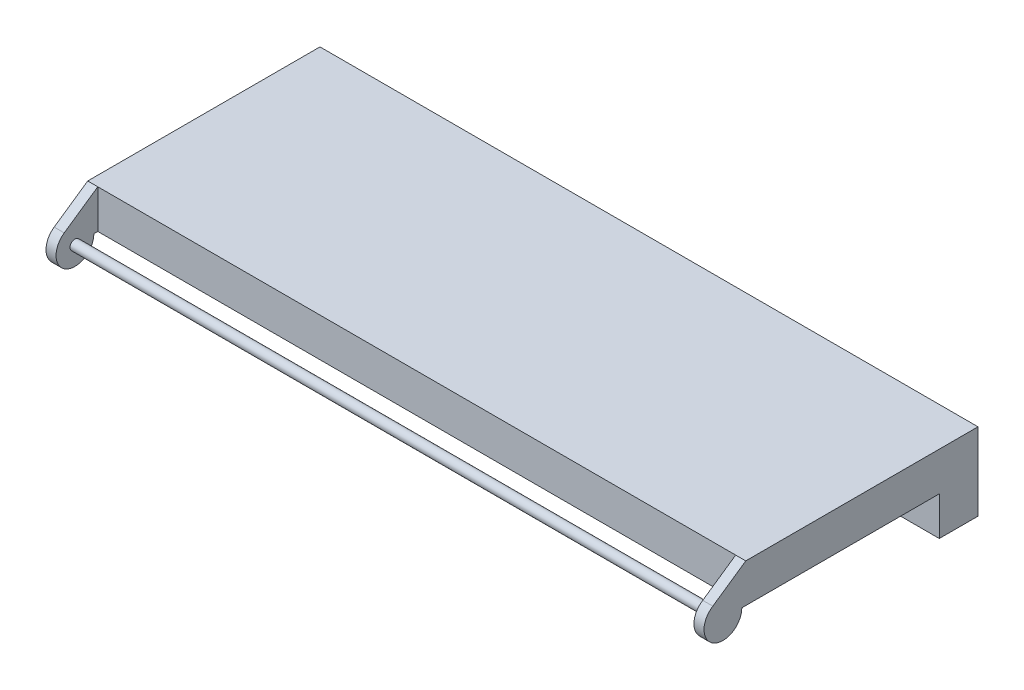
from build123d import *

# Parameters (mm, degrees)
SKETCH1_W             = 85
SKETCH1_H             = 30
TOP_SURFACE_DEPTH     = 10
SKETCH6_W             = 25
SKETCH6_H             = 5
TOP_SURFACE_CUT_DEPTH = 91.691785736
SKETCH9_R             = 0.64
BOSS_EXTRUDE3_DEPTH   = 85
SKETCH11_R            = 0.64
BOSS_EXTRUDE8_DEPTH   = 1.3
SKETCH9_14_R          = 0.64
BOSS_EXTRUDE9_DEPTH   = 1.3


with BuildPart() as part:
    # Sketch1 → Top surface (new body)
    with BuildSketch(Plane(origin=(0, 0, 0), x_dir=(1, 0, 0), z_dir=(0, 1, 0))):
        with Locations((42.5, 15)):
            Rectangle(SKETCH1_W, SKETCH1_H)
    extrude(amount=TOP_SURFACE_DEPTH)

    # Sketch6 → Top surface cut (cut, through all)
    with BuildSketch(Plane.ZY):
        with Locations((-12.5, 2.5)):
            Rectangle(SKETCH6_W, SKETCH6_H)
    extrude(amount=-TOP_SURFACE_CUT_DEPTH, mode=Mode.SUBTRACT)



with BuildPart() as body_2:
    # Sketch9 → Boss-Extrude3 (new body)
    with BuildSketch(Plane.ZY):
        with Locations((2.95, 5)):
            Circle(SKETCH9_R)
    extrude(amount=-BOSS_EXTRUDE3_DEPTH)


with BuildPart() as part_1:
    add(part.part)

    add(body_2.part)  # Boss-Extrude8 merges body 2
    # Sketch11 → Boss-Extrude8 (add)
    with BuildSketch(Plane(origin=(85, 0, 0), x_dir=(0, 0, -1), z_dir=(1, 0, 0))):
        with BuildLine():
            Line((0, 10), (-4.253295767, 7.062770017))
            ThreePointArc((-4.253295767, 7.062770017), (-4.127615881, 2.862987872), (-0.51, 5))
            Line((-0.51, 5), (0, 5))
            Line((0, 5), (0, 10))
        make_face()
        with Locations((-2.95, 5)):
            Circle(SKETCH11_R, mode=Mode.SUBTRACT)
    extrude(amount=-BOSS_EXTRUDE8_DEPTH)

    # Sketch9<14> → Boss-Extrude9 (add)
    with BuildSketch(Plane.ZY):
        with BuildLine():
            Line((0, 5), (0.51, 5))
            ThreePointArc((0.51, 5), (4.084103284, 2.839581119), (4.33574569, 7.008309957))
            Line((4.33574569, 7.008309957), (0, 10))
            Line((0, 10), (0, 5))
        make_face()
        with Locations((2.95, 5)):
            Circle(SKETCH9_14_R, mode=Mode.SUBTRACT)
    extrude(amount=-BOSS_EXTRUDE9_DEPTH)


solid = part_1.part
